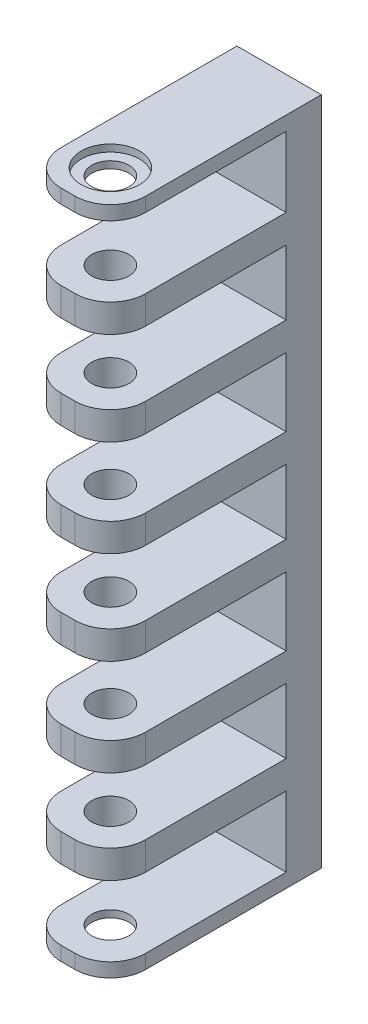
from build123d import *

# Parameters (mm, degrees)
SKETCH1_W            = 95.25
SKETCH1_H            = 12
BOSS_EXTRUDE1_DEPTH  = 5
SKETCH3_W            = 12
SKETCH3_H            = 2
SKETCH3_H_2          = 4
BOSS_EXTRUDE2_DEPTH  = 25
FILLET1_R            = 5
FILLET1_OF_MIRROR1_R = 5
SKETCH5_R            = 2.65
CUT_EXTRUDE1_DEPTH   = 101.581123975
SKETCH7_R            = 4.15
SKETCH7_R_2          = 2.65
CUT_EXTRUDE2_DEPTH   = 1


with BuildPart() as part:
    # Sketch1 → Boss-Extrude1 (new body)
    with BuildSketch(Plane(origin=(0, 0, 0), x_dir=(0, 1, 0), z_dir=(0, 0, 1))):
        with Locations((-47.625, 6)):
            Rectangle(SKETCH1_W, SKETCH1_H)
    extrude(amount=BOSS_EXTRUDE1_DEPTH)

    # Sketch3 → Boss-Extrude2 (add)
    with BuildSketch(Plane.XY.offset(5)):
        with Locations((-6, -1)):
            Rectangle(SKETCH3_W, SKETCH3_H)
        with Locations((-6, -14)):
            Rectangle(SKETCH3_W, SKETCH3_H_2)
        with Locations((-6, -27.25)):
            Rectangle(SKETCH3_W, SKETCH3_H_2)
        with Locations((-6, -41)):
            Rectangle(SKETCH3_W, SKETCH3_H_2)
    boss_extrude2 = extrude(amount=BOSS_EXTRUDE2_DEPTH)

    # Fillet1
    fillet1_edges = [part.edges().sort_by_distance(p)[0] for p in [
        (-12, -1, 30),
        (0, -1, 30),
        (-12, -14, 30),
        (0, -14, 30),
        (-12, -41, 30),
        (-12, -27.25, 30),
        (0, -27.25, 30),
        (0, -41, 30),
    ]]
    fillet(fillet1_edges, radius=FILLET1_R)

    # Mirror1: Boss-Extrude2 across plane
    add(boss_extrude2.mirror(Plane.ZX.offset(-47.625)))

    # Fillet1 of Mirror1
    fillet1_of_mirror1_edges = [part.edges().sort_by_distance(p)[0] for p in [
        (-12, -94.25, 30),
        (0, -94.25, 30),
        (-12, -81.25, 30),
        (0, -81.25, 30),
        (-12, -54.25, 30),
        (-12, -68, 30),
        (0, -68, 30),
        (0, -54.25, 30),
    ]]
    fillet(fillet1_of_mirror1_edges, radius=FILLET1_OF_MIRROR1_R)

    # Sketch5 → Cut-Extrude1 (cut, through all)
    with BuildSketch(Plane(origin=(0, 0, 0), x_dir=(-1, 0, 0), z_dir=(0, 1, 0))):
        with Locations((6, 24)):
            Circle(SKETCH5_R)
    extrude(amount=-CUT_EXTRUDE1_DEPTH, mode=Mode.SUBTRACT)

    # Sketch7 → Cut-Extrude2 (cut)
    with BuildSketch(Plane(origin=(0, 0, 0), x_dir=(-1, 0, 0), z_dir=(0, 1, 0))):
        with Locations((6, 24)):
            Circle(SKETCH7_R)
        with Locations((6, 24)):
            Circle(SKETCH7_R_2, mode=Mode.SUBTRACT)
    cut_extrude2 = extrude(amount=-CUT_EXTRUDE2_DEPTH, mode=Mode.SUBTRACT)

    # Mirror2: Cut-Extrude2 across plane
    add(cut_extrude2.mirror(Plane.ZX.offset(-47.625)), mode=Mode.SUBTRACT)


solid = part.part
